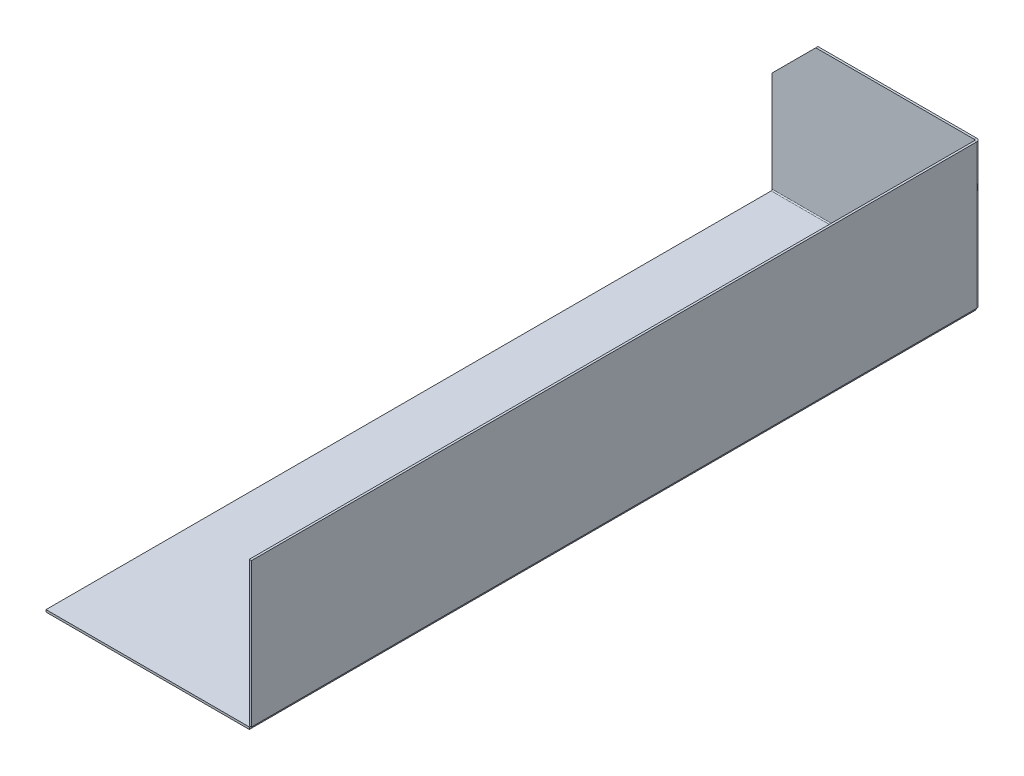
from build123d import *

# Parameters (mm, degrees)
TABAN_FLAN_2_DEPTH           = 1.5
KENAR_FLAN_5_STRIP_W         = 7.4732
KENAR_FLAN_5_STRIP_H         = 1.5
KENAR_FLAN_5_STRIP_CUT_DEPTH = 140
KENAR_FLAN_5_DEPTH           = 140
KENAR_FLAN_6_STRIP_W         = 7.4732
KENAR_FLAN_6_STRIP_H         = 1.5
KENAR_FLAN_6_STRIP_CUT_DEPTH = 99.2634
KENAR_FLAN_6_DEPTH           = 99.2634


# Sheet-metal steps are written as plain solids
with BuildPart() as part:
    # Çizim1 → Taban-Flanş2 (new body)
    with BuildSketch(Plane.XY):
        Polygon((0, 0), (0, 70), (30, 100), (140, 100), (140, 0), align=None)
    extrude(amount=-TABAN_FLAN_2_DEPTH)

    # Kenar-Flanş5 strip (across the edge) → Kenar-Flanş5 strip cut (cut)
    with BuildSketch(Plane.YZ):
        with Locations((-3, -0.75)):
            Rectangle(KENAR_FLAN_5_STRIP_W, KENAR_FLAN_5_STRIP_H)
    extrude(amount=KENAR_FLAN_5_STRIP_CUT_DEPTH, mode=Mode.SUBTRACT)

    # Kenar-Flanş5 section (across the edge) → Kenar-Flanş5 (add)
    with BuildSketch(Plane.YZ):
        with BuildLine():
            Line((-1.5, 0.7366), (-1.5, 500))
            Line((-1.5, 500), (0, 500))
            Line((0, 500), (0, 0.7366))
            ThreePointArc((0, 0.7366), (0.215745145, 0.215745145), (0.7366, 0))
            Line((0.7366, 0), (0.7366, -1.5))
            ThreePointArc((0.7366, -1.5), (-0.844915027, -0.844915027), (-1.5, 0.7366))
        make_face()
    extrude(amount=KENAR_FLAN_5_DEPTH)

    # Kenar-Flanş6 strip (across the edge) → Kenar-Flanş6 strip cut (cut)
    with BuildSketch(Plane(origin=(140, 0.7366, 0), x_dir=(-1, 0, 0), z_dir=(0, 1, 0))):
        with Locations((-3, -0.75)):
            Rectangle(KENAR_FLAN_6_STRIP_W, KENAR_FLAN_6_STRIP_H)
    extrude(amount=KENAR_FLAN_6_STRIP_CUT_DEPTH, mode=Mode.SUBTRACT)

    # Kenar-Flanş6 section (across the edge) → Kenar-Flanş6 (add)
    with BuildSketch(Plane(origin=(140, 0.7366, 0), x_dir=(-1, 0, 0), z_dir=(0, 1, 0))):
        with BuildLine():
            Line((-1.5, 0.7366), (-1.5, 500))
            Line((-1.5, 500), (0, 500))
            Line((0, 500), (0, 0.7366))
            ThreePointArc((0, 0.7366), (0.215745145, 0.215745145), (0.7366, 0))
            Line((0.7366, 0), (0.7366, -1.5))
            ThreePointArc((0.7366, -1.5), (-0.844915027, -0.844915027), (-1.5, 0.7366))
        make_face()
    extrude(amount=KENAR_FLAN_6_DEPTH)


solid = part.part
